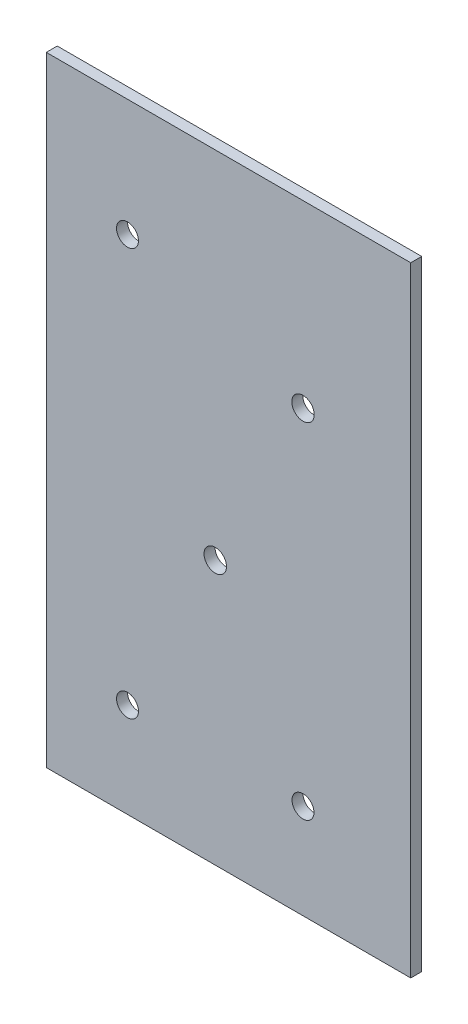
from build123d import *

# Parameters (mm, degrees)
SKETCH1_W           = 105.497827183
SKETCH1_H           = 179.29887024
SKETCH1_R           = 3.175
SKETCH1_R_2         = 3.2512
BOSS_EXTRUDE1_DEPTH = 3.175


with BuildPart() as part:
    # Sketch1 → Boss-Extrude1 (new body)
    with BuildSketch(Plane.XY):
        with Locations((54.6380005, 121.166691813)):
            Rectangle(SKETCH1_W, SKETCH1_H)
        with Locations((25.4, 58.964285714)):
            Circle(SKETCH1_R, mode=Mode.SUBTRACT)
        with Locations((76.2, 58.964285714)):
            Circle(SKETCH1_R, mode=Mode.SUBTRACT)
        with Locations((25.4, 176.892857143)):
            Circle(SKETCH1_R, mode=Mode.SUBTRACT)
        with Locations((76.2, 158.75)):
            Circle(SKETCH1_R_2, mode=Mode.SUBTRACT)
        with Locations((50.8, 107.95)):
            Circle(SKETCH1_R_2, mode=Mode.SUBTRACT)
    extrude(amount=BOSS_EXTRUDE1_DEPTH)


solid = part.part
